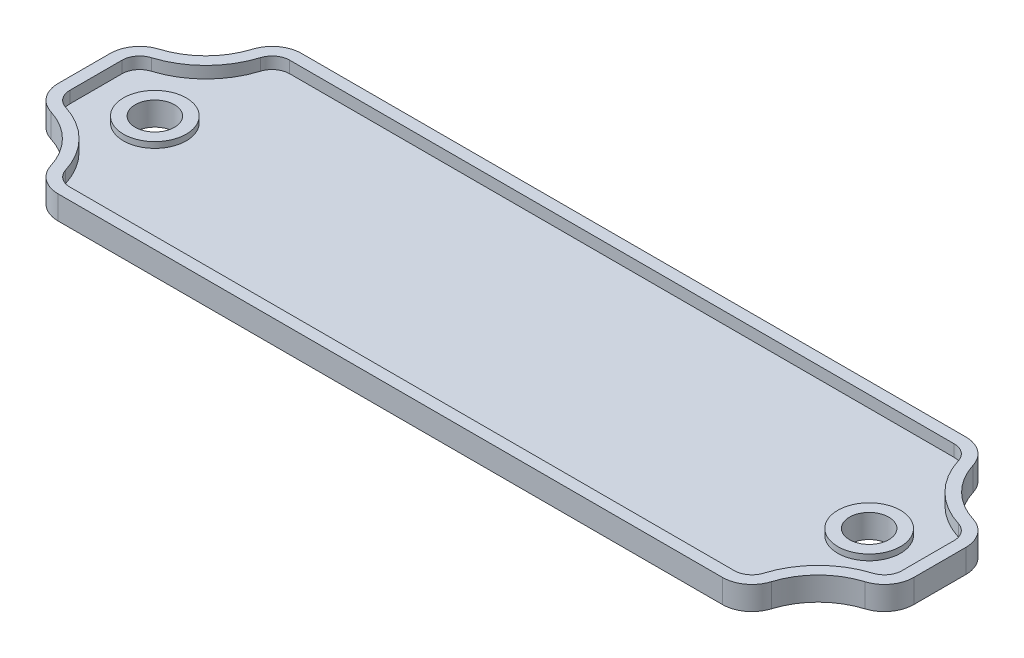
from build123d import *

# Parameters (mm, degrees)
SKETCH2_R           = 4
SKETCH2_R_2         = 2.5
BOSS_EXTRUDE1_DEPTH = 0.75
SKETCH2_4_R         = 4
SKETCH2_4_R_2       = 2.5
BOSS_EXTRUDE2_DEPTH = 0.75
BOSS_EXTRUDE3_DEPTH = 3
BOSS_EXTRUDE4_START = 1.5
SKETCH2_6_R         = 4
BOSS_EXTRUDE4_DEPTH = 1.5
BOSS_EXTRUDE5_START = 2.25
SKETCH2_7_R         = 4
SKETCH2_7_R_2       = 2.5
BOSS_EXTRUDE5_DEPTH = 2.25
BOSS_EXTRUDE6_START = 2.25
SKETCH2_8_R         = 4
SKETCH2_8_R_2       = 2.5
BOSS_EXTRUDE6_DEPTH = 2.25


with BuildPart() as part:
    # Sketch2 → Boss-Extrude1 (new body)
    with BuildSketch(Plane(origin=(0, 0, 0), x_dir=(1, 0, 0), z_dir=(0, 1, 0))):
        with Locations((-45.5, 0)):
            Circle(SKETCH2_R)
        with Locations((-45.5, 0)):
            Circle(SKETCH2_R_2, mode=Mode.SUBTRACT)
    extrude(amount=-BOSS_EXTRUDE1_DEPTH)



with BuildPart() as body_2:
    # Sketch2<4> → Boss-Extrude2 (new body)
    with BuildSketch(Plane(origin=(0, 0, 0), x_dir=(1, 0, 0), z_dir=(0, 1, 0))):
        with Locations((45.5, 0)):
            Circle(SKETCH2_4_R)
        with Locations((45.5, 0)):
            Circle(SKETCH2_4_R_2, mode=Mode.SUBTRACT)
    extrude(amount=-BOSS_EXTRUDE2_DEPTH)


with BuildPart() as body_3:
    # Sketch2<5> → Boss-Extrude3 (new body)
    with BuildSketch(Plane(origin=(0, 0, 0), x_dir=(1, 0, 0), z_dir=(0, 1, 0))):
        with BuildLine():
            Line((42.313942393, 15.5), (-42.313942393, 15.5))
            ThreePointArc((-42.313942393, 15.5), (-44.541774365, 14.76649875), (-45.898076983, 12.852941176))
            ThreePointArc((-45.898076983, 12.852941176), (-48.136038969, 9.136038969), (-51.852941176, 6.898076983))
            ThreePointArc((-51.852941176, 6.898076983), (-53.76649875, 5.541774365), (-54.5, 3.313942393))
            Line((-54.5, 3.313942393), (-54.5, -3.313942393))
            ThreePointArc((-54.5, -3.313942393), (-53.76649875, -5.541774365), (-51.852941176, -6.898076983))
            ThreePointArc((-51.852941176, -6.898076983), (-48.136038969, -9.136038969), (-45.898076983, -12.852941176))
            ThreePointArc((-45.898076983, -12.852941176), (-44.541774365, -14.76649875), (-42.313942393, -15.5))
            Line((-42.313942393, -15.5), (42.313942393, -15.5))
            ThreePointArc((42.313942393, -15.5), (44.541774365, -14.76649875), (45.898076983, -12.852941176))
            ThreePointArc((45.898076983, -12.852941176), (48.136038969, -9.136038969), (51.852941176, -6.898076983))
            ThreePointArc((51.852941176, -6.898076983), (53.76649875, -5.541774365), (54.5, -3.313942393))
            Line((54.5, -3.313942393), (54.5, 3.313942393))
            ThreePointArc((54.5, 3.313942393), (53.76649875, 5.541774365), (51.852941176, 6.898076983))
            ThreePointArc((51.852941176, 6.898076983), (48.136038969, 9.136038969), (45.898076983, 12.852941176))
            ThreePointArc((45.898076983, 12.852941176), (44.541774365, 14.76649875), (42.313942393, 15.5))
        make_face()
        with BuildLine():
            ThreePointArc((-44.464423147, 12.411764706), (-43.650641576, 13.55989925), (-42.313942393, 14))
            Line((-42.313942393, 14), (42.313942393, 14))
            ThreePointArc((42.313942393, 14), (43.650641576, 13.55989925), (44.464423147, 12.411764706))
            ThreePointArc((44.464423147, 12.411764706), (47.075378798, 8.075378798), (51.411764706, 5.464423147))
            ThreePointArc((51.411764706, 5.464423147), (52.55989925, 4.650641576), (53, 3.313942393))
            Line((53, 3.313942393), (53, -3.313942393))
            ThreePointArc((53, -3.313942393), (52.55989925, -4.650641576), (51.411764706, -5.464423147))
            ThreePointArc((51.411764706, -5.464423147), (47.075378798, -8.075378798), (44.464423147, -12.411764706))
            ThreePointArc((44.464423147, -12.411764706), (43.650641576, -13.55989925), (42.313942393, -14))
            Line((42.313942393, -14), (-42.313942393, -14))
            ThreePointArc((-42.313942393, -14), (-43.650641576, -13.55989925), (-44.464423147, -12.411764706))
            ThreePointArc((-44.464423147, -12.411764706), (-47.075378798, -8.075378798), (-51.411764706, -5.464423147))
            ThreePointArc((-51.411764706, -5.464423147), (-52.55989925, -4.650641576), (-53, -3.313942393))
            Line((-53, -3.313942393), (-53, 3.313942393))
            ThreePointArc((-53, 3.313942393), (-52.55989925, 4.650641576), (-51.411764706, 5.464423147))
            ThreePointArc((-51.411764706, 5.464423147), (-47.075378798, 8.075378798), (-44.464423147, 12.411764706))
        make_face(mode=Mode.SUBTRACT)
    extrude(amount=BOSS_EXTRUDE3_DEPTH)

    # Sketch2<6> → Boss-Extrude4 (add)
    with BuildSketch(Plane(origin=(0, 0, 0), x_dir=(1, 0, 0), z_dir=(0, 1, 0)).offset(BOSS_EXTRUDE4_START)):
        with BuildLine():
            Line((42.313942393, 14), (-42.313942393, 14))
            ThreePointArc((-42.313942393, 14), (-43.650641576, 13.55989925), (-44.464423147, 12.411764706))
            ThreePointArc((-44.464423147, 12.411764706), (-47.075378798, 8.075378798), (-51.411764706, 5.464423147))
            ThreePointArc((-51.411764706, 5.464423147), (-52.55989925, 4.650641576), (-53, 3.313942393))
            Line((-53, 3.313942393), (-53, -3.313942393))
            ThreePointArc((-53, -3.313942393), (-52.55989925, -4.650641576), (-51.411764706, -5.464423147))
            ThreePointArc((-51.411764706, -5.464423147), (-47.075378798, -8.075378798), (-44.464423147, -12.411764706))
            ThreePointArc((-44.464423147, -12.411764706), (-43.650641576, -13.55989925), (-42.313942393, -14))
            Line((-42.313942393, -14), (42.313942393, -14))
            ThreePointArc((42.313942393, -14), (43.650641576, -13.55989925), (44.464423147, -12.411764706))
            ThreePointArc((44.464423147, -12.411764706), (47.075378798, -8.075378798), (51.411764706, -5.464423147))
            ThreePointArc((51.411764706, -5.464423147), (52.55989925, -4.650641576), (53, -3.313942393))
            Line((53, -3.313942393), (53, 3.313942393))
            ThreePointArc((53, 3.313942393), (52.55989925, 4.650641576), (51.411764706, 5.464423147))
            ThreePointArc((51.411764706, 5.464423147), (47.075378798, 8.075378798), (44.464423147, 12.411764706))
            ThreePointArc((44.464423147, 12.411764706), (43.650641576, 13.55989925), (42.313942393, 14))
        make_face()
        with Locations((-45.5, 0)):
            Circle(SKETCH2_6_R, mode=Mode.SUBTRACT)
        with Locations((45.5, 0)):
            Circle(SKETCH2_6_R, mode=Mode.SUBTRACT)
    extrude(amount=-BOSS_EXTRUDE4_DEPTH)


with BuildPart() as part_1:
    add(part.part)

    add(body_3.part)  # Boss-Extrude5 merges body 3
    # Sketch2<7> → Boss-Extrude5 (add)
    with BuildSketch(Plane(origin=(0, 0, 0), x_dir=(1, 0, 0), z_dir=(0, 1, 0)).offset(BOSS_EXTRUDE5_START)):
        with Locations((-45.5, 0)):
            Circle(SKETCH2_7_R)
        with Locations((-45.5, 0)):
            Circle(SKETCH2_7_R_2, mode=Mode.SUBTRACT)
    extrude(amount=-BOSS_EXTRUDE5_DEPTH)


    add(body_2.part)  # Boss-Extrude6 merges body 2
    # Sketch2<8> → Boss-Extrude6 (add)
    with BuildSketch(Plane(origin=(0, 0, 0), x_dir=(1, 0, 0), z_dir=(0, 1, 0)).offset(BOSS_EXTRUDE6_START)):
        with Locations((45.5, 0)):
            Circle(SKETCH2_8_R)
        with Locations((45.5, 0)):
            Circle(SKETCH2_8_R_2, mode=Mode.SUBTRACT)
    extrude(amount=-BOSS_EXTRUDE6_DEPTH)


solid = part_1.part
